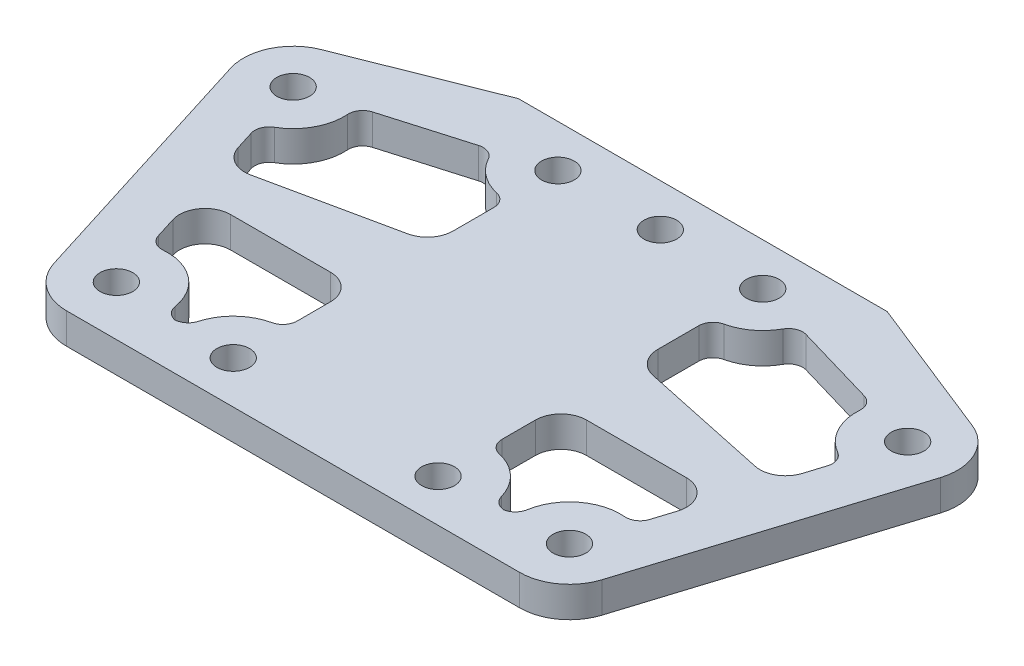
from build123d import *

# Parameters (mm, degrees)
SKETCH_1_R             = 1.6
EXTRUDE_1_DEPTH        = 3
SKETCH_2_R             = 1.6
CUT_EXTRUDE_1_DEPTH    = 59.077534383
CUT_EXTRUDE_2_DEPTH    = 10
CUT_EXTRUDE_3_DEPTH    = 10
FILLET_1_R             = 2.5
FILLET_2_R             = 1.4
FILLET_1_OF_MIRROR_1_R = 2.5
FILLET_2_OF_MIRROR_1_R = 1.4


with BuildPart() as part:
    # 草图1 → 凸台-拉伸1 (new body)
    with BuildSketch(Plane(origin=(0, 0, 0), x_dir=(1, 0, 0), z_dir=(0, 1, 0))):
        Polygon((42, 0), (-42, 0), (-42, 40), (0, 40), (42, 40), align=None)
        with Locations(Location((-22.12, 4.86, 0), (0, 0, 270))):
            Circle(SKETCH_1_R, mode=Mode.SUBTRACT)
        with Locations(Location((-30, 30, 0), (0, 0, 270))):
            Circle(SKETCH_1_R, mode=Mode.SUBTRACT)
        with Locations(Location((30, 30, 0), (0, 0, 90))):
            Circle(SKETCH_1_R, mode=Mode.SUBTRACT)
        with Locations(Location((22.12, 4.86, 0), (0, 0, 90))):
            Circle(SKETCH_1_R, mode=Mode.SUBTRACT)
    extrude(amount=EXTRUDE_1_DEPTH)

    # 草图2 → 切除-拉伸1 (cut, through all)
    with BuildSketch(Plane(origin=(0, 3, 0), x_dir=(1, 0, 0), z_dir=(0, 1, 0))):
        with Locations(Location((-10, 35.85, 0), (0, 0, 270))):
            Circle(SKETCH_2_R)
        with Locations(Location((10, 35.85, 0), (0, 0, 270))):
            Circle(SKETCH_2_R)
        with Locations(Location((-10, 4.15, 0), (0, 0, 270))):
            Circle(SKETCH_2_R)
        with Locations(Location((10, 4.15, 0), (0, 0, 270))):
            Circle(SKETCH_2_R)
        with Locations(Location((0, 35.85, 0), (0, 0, 270))):
            Circle(SKETCH_2_R)
    extrude(amount=-CUT_EXTRUDE_1_DEPTH, mode=Mode.SUBTRACT)

    # 草图3 → 切除-拉伸2 (cut)
    with BuildSketch(Plane(origin=(0, 3, 0), x_dir=(1, 0, 0), z_dir=(0, 1, 0))):
        with BuildLine():
            ThreePointArc((-22.12, 0), (-24.997070445, 0.943105101), (-26.757523684, 3.406392735))
            Line((-26.757523684, 3.406392735), (-34.637523684, 28.546392735))
            ThreePointArc((-34.637523684, 28.546392735), (-34.388052817, 32.089160711), (-31.795255063, 34.516266075))
            Line((-31.795255063, 34.516266075), (-18, 40))
            Line((-18, 40), (-42, 40))
            Line((-42, 40), (-42, 0))
            Line((-42, 0), (-22.12, 0))
        make_face()
        with BuildLine():
            ThreePointArc((26.757523684, 3.406392735), (24.997070445, 0.943105101), (22.12, 0))
            Line((22.12, 0), (42, 0))
            Line((42, 0), (42, 40))
            Line((42, 40), (18, 40))
            Line((18, 40), (31.795255063, 34.516266075))
            ThreePointArc((31.795255063, 34.516266075), (34.021476073, 32.728979699), (34.86, 30))
            ThreePointArc((34.86, 30), (34.804058966, 29.264733077), (34.637523684, 28.546392735))
            Line((34.637523684, 28.546392735), (26.757523684, 3.406392735))
        make_face()
    extrude(amount=-CUT_EXTRUDE_2_DEPTH, mode=Mode.SUBTRACT)

    # 草图4 → 切除-拉伸3 (cut)
    with BuildSketch(Plane(origin=(0, 3, 0), x_dir=(1, 0, 0), z_dir=(0, 1, 0))):
        with BuildLine():
            Line((-14.798923626, 34.446314839), (-25.201076374, 31.403685161))
            ThreePointArc((-25.201076374, 31.403685161), (-25.050524365, 30.709007006), (-25, 30))
            ThreePointArc((-25, 30), (-25.970272737, 27.040050982), (-28.504519275, 25.228885099))
            Line((-28.504519275, 25.228885099), (-26.865552904, 20))
            Line((-26.865552904, 20), (-10, 23.584883936))
            Line((-10, 23.584883936), (-10, 30.85))
            ThreePointArc((-10, 30.85), (-12.998464123, 31.848848553), (-14.798923626, 34.446314839))
        make_face()
        with BuildLine():
            Line((-10, 16.15), (-25.658790772, 16.15))
            Line((-25.658790772, 16.15), (-23.615480725, 9.631114901))
            ThreePointArc((-23.615480725, 9.631114901), (-19.160050982, 8.889727263), (-17.12, 4.86))
            ThreePointArc((-17.12, 4.86), (-17.122139776, 4.713735907), (-17.128557274, 4.567597002))
            Line((-17.128557274, 4.567597002), (-14.991442726, 4.442402998))
            ThreePointArc((-14.991442726, 4.442402998), (-13.430596523, 7.787445188), (-10, 9.15))
            Line((-10, 9.15), (-10, 16.15))
        make_face()
    cut_extrude_3 = extrude(amount=-CUT_EXTRUDE_3_DEPTH, mode=Mode.SUBTRACT)

    # 圆角1
    fillet_1_edges = [part.edges().sort_by_distance(p)[0] for p in [
        (-10, 1.5, -23.584883936),
        (-26.865552904, 1.5, -20),
        (-25.658790772, 1.5, -16.15),
        (-10, 1.5, -16.15),
    ]]
    fillet(fillet_1_edges, radius=FILLET_1_R)

    # 圆角2
    # the kernel refuses this fillet: 1.4 mm, written as the material it adds along each edge
    with BuildSketch(Plane(origin=(-23.615480725, 3, -9.631114901), x_dir=(0.9813413175629745, 0, -0.1922738111230053), z_dir=(0, -1, 0)), Plane(origin=(-14.991442726, 3, -4.442402998), x_dir=(0.1679804165145185, 0, -0.9857903325086977), z_dir=(0, -1, 0))) as fillet_2_piece_1:
        with BuildLine():
            CenterArc((1.254493801, -1.391497509), FILLET_2_R, 96.317812547, 77.364374907)
            Line((-0.137003708, -1.237436867), (0, 0))
            ThreePointArc((0, 0), (0.55021658, -0.030366038), (1.100433159, 0))
        make_face()
    extrude(amount=3)
    with BuildSketch(Plane(origin=(-10, 3, -9.15), x_dir=(0, 0, -1), z_dir=(0, -1, 0)), Plane(origin=(-17.128557274, 3, -4.567597002), x_dir=(0.998288545196741, 0, 0.058480599594858615), z_dir=(0, -1, 0))) as fillet_2_piece_2:
        with BuildLine():
            CenterArc((1.244997998, -1.4), FILLET_2_R, 90, 77.364374907)
            ThreePointArc((-0.121095314, -1.09375), (-0.030366038, -0.55021658), (0, 0))
            Line((0, 0), (1.244997998, 0))
        make_face()
    extrude(amount=3)
    with BuildSketch(Plane(origin=(-10, 3, -30.85), x_dir=(0, 0, 1), z_dir=(0, -1, 0)), Plane(origin=(-25.201076374, 3, -31.403685161), x_dir=(0.9597847252329514, 0, -0.2807370321306184), z_dir=(0, -1, 0))) as fillet_2_piece_3:
        with BuildLine():
            CenterArc((1.244997998, 1.4), FILLET_2_R, 192.635625093, 77.364374907)
            ThreePointArc((-0.121095314, 1.09375), (-0.030366038, 0.55021658), (0, 0))
            Line((0, 0), (1.244997998, 0))
        make_face()
    extrude(amount=3)
    with BuildSketch(Plane(origin=(-14.798923626, 3, -34.446314839), x_dir=(0.3846499515684246, 0, 0.9230625194202224), z_dir=(0, -1, 0)), Plane(origin=(-28.504519275, 3, -25.228885099), x_dir=(0.9155142544303774, 0, -0.4022855328430172), z_dir=(0, -1, 0))) as fillet_2_piece_4:
        with BuildLine():
            CenterArc((1.254493801, 1.391497509), FILLET_2_R, 186.317812547, 77.364374907)
            Line((-0.137003708, 1.237436867), (0, 0))
            ThreePointArc((0, 0), (0.55021658, 0.030366038), (1.100433159, 0))
        make_face()
    extrude(amount=3)

    # 镜向1: 切除-拉伸3 across plane
    add(cut_extrude_3.mirror(Plane(origin=(0, 0, 0), x_dir=(0, 0, 1), z_dir=(1, 0, 0))), mode=Mode.SUBTRACT)

    # 圆角1 of 镜向1
    fillet_1_of_mirror_1_edges = [part.edges().sort_by_distance(p)[0] for p in [
        (10, 1.5, -23.584883936),
        (26.865552904, 1.5, -20),
        (25.658790772, 1.5, -16.15),
        (10, 1.5, -16.15),
    ]]
    fillet(fillet_1_of_mirror_1_edges, radius=FILLET_1_OF_MIRROR_1_R)

    # 圆角2 of 镜向1
    # the kernel refuses this fillet: 1.4 mm, written as the material it adds along each edge
    with BuildSketch(Plane(origin=(23.615480725, 3, -9.631114901), x_dir=(0.2990961449676297, 0, -0.9542229802648344), z_dir=(0, -1, 0)), Plane(origin=(10, 3, -30.85), x_dir=(0, 0, 1), z_dir=(0, -1, 0)), Plane(origin=(25.201076374, 3, -31.403685161), x_dir=(-0.9597847252329514, 0, -0.2807370321306184), z_dir=(0, -1, 0)), Plane(origin=(14.991442726, 3, -4.442402998), x_dir=(0.9982885451967423, 0, -0.05848059959483981), z_dir=(0, -1, 0))) as fillet_2_of_mirror_1_piece_1:
        with BuildLine():
            CenterArc((1.244997998, -1.4), FILLET_2_OF_MIRROR_1_R, 90, 77.364374907)
            ThreePointArc((-0.121095314, -1.09375), (-0.030366038, -0.55021658), (0, 0))
            Line((0, 0), (1.244997998, 0))
        make_face()
    extrude(amount=3)
    with BuildSketch(Plane(origin=(10, 3, -9.15), x_dir=(0.993926792387083, 0, 0.11004331590389448), z_dir=(0, -1, 0)), Plane(origin=(14.798923626, 3, -34.446314839), x_dir=(-0.3846499515684246, 0, 0.9230625194202224), z_dir=(0, -1, 0)), Plane(origin=(28.504519275, 3, -25.228885099), x_dir=(-0.9155142544303774, 0, -0.4022855328430172), z_dir=(0, -1, 0)), Plane(origin=(17.128557274, 3, -4.567597002), x_dir=(0.05172954697013894, 0, -0.9986611306996304), z_dir=(0, -1, 0))) as fillet_2_of_mirror_1_piece_2:
        with BuildLine():
            CenterArc((1.254493801, -1.391497509), FILLET_2_OF_MIRROR_1_R, 96.317812547, 77.364374907)
            Line((-0.137003708, -1.237436867), (0, 0))
            ThreePointArc((0, 0), (0.55021658, -0.030366038), (1.100433159, 0))
        make_face()
    extrude(amount=3)


solid = part.part
